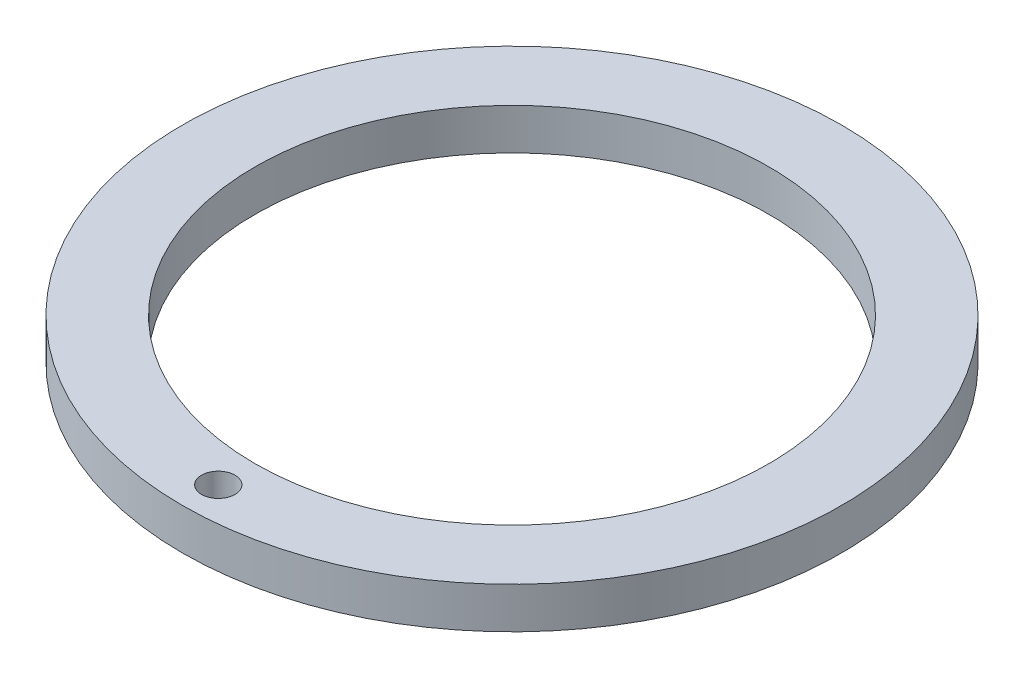
from build123d import *

# Parameters (mm, degrees)
SKETCH1_R            = 50.8
SKETCH1_R_2          = 39.624
RING_EXTRUSION_DEPTH = 6.35
SKETCH2_R            = 2.5796875
CONDUIT_HOLE_DEPTH   = 73.122135992


with BuildPart() as part:
    # Sketch1 → Ring Extrusion (new body)
    with BuildSketch(Plane(origin=(0, 0, 0), x_dir=(1, 0, 0), z_dir=(0, 1, 0))):
        Circle(SKETCH1_R)
        Circle(SKETCH1_R_2, mode=Mode.SUBTRACT)
    extrude(amount=RING_EXTRUSION_DEPTH)

    # Sketch2 → Conduit Hole (cut, through all)
    with BuildSketch(Plane(origin=(0, 0, 0), x_dir=(1, 0, 0), z_dir=(0, 1, 0))):
        with Locations((0, -45.2755)):
            Circle(SKETCH2_R)
    extrude(amount=CONDUIT_HOLE_DEPTH, mode=Mode.SUBTRACT)


solid = part.part
